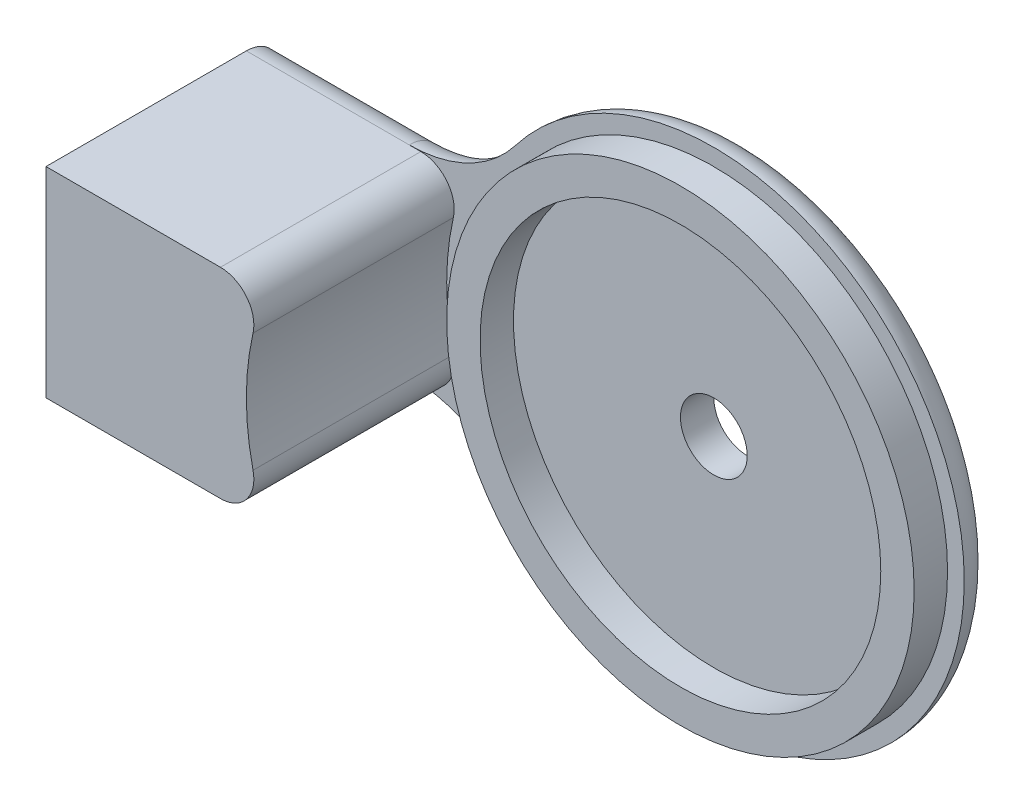
from build123d import *

# Parameters (mm, degrees)
ESQUISSE1_R        = 5
BOSS_EXTRU_1_DEPTH = 5
ESQUISSE6_R        = 35
ESQUISSE6_R_2      = 30
BOSS_EXTRU_6_DEPTH = 5
BOSS_EXTRU_9_DEPTH = 30
CONG_3_R           = 5


with BuildPart() as part:
    # Esquisse1 → Boss.-Extru.1 (new body)
    with BuildSketch(Plane.XY):
        with BuildLine():
            Line((-45.620718977, 15), (-70, 15))
            Line((-70, 15), (-70, -15))
            Line((-70, -15), (-45.620718977, -15))
            ThreePointArc((-45.620718977, -15), (-36.774201608, -17.062911874), (-29.752642811, -22.826086957))
            ThreePointArc((-29.752642811, -22.826086957), (37.5, 0), (-29.752642811, 22.826086957))
            ThreePointArc((-29.752642811, 22.826086957), (-36.774201608, 17.062911874), (-45.620718977, 15))
        make_face()
        Circle(ESQUISSE1_R, mode=Mode.SUBTRACT)
    extrude(amount=BOSS_EXTRU_1_DEPTH)

    # Esquisse6 → Boss.-Extru.6 (add)
    with BuildSketch(Plane.XY.offset(5)):
        Circle(ESQUISSE6_R)
        Circle(ESQUISSE6_R_2, mode=Mode.SUBTRACT)
    extrude(amount=BOSS_EXTRU_6_DEPTH)

    # Esquisse8 → Boss.-Extru.9 (add)
    with BuildSketch(Plane.XY.offset(5)):
        with BuildLine():
            Line((-70, -15), (-70, 15))
            Line((-70, 15), (-43.874821937, 15))
            ThreePointArc((-43.874821937, 15), (-39.966142137, 13.118047822), (-38.999841722, 8.888888889))
            ThreePointArc((-38.999841722, 8.888888889), (-40, 0), (-38.999841722, -8.888888889))
            ThreePointArc((-38.999841722, -8.888888889), (-39.966142137, -13.118047822), (-43.874821937, -15))
            Line((-43.874821937, -15), (-70, -15))
        make_face()
    extrude(amount=BOSS_EXTRU_9_DEPTH)

    # Congé3
    cong_3_edges = [part.edges().sort_by_distance(p)[0] for p in [
        (37.5, 0, 0),
        (-57.810359489, 15, 0),
        (-57.810359489, -15, 0),
        (-36.774201608, -17.062911874, 0),
        (-36.774201608, 17.062911874, 0),
    ]]
    fillet(cong_3_edges, radius=CONG_3_R - 0.0001)  # a hair under: the kernel refuses the full size


solid = part.part
